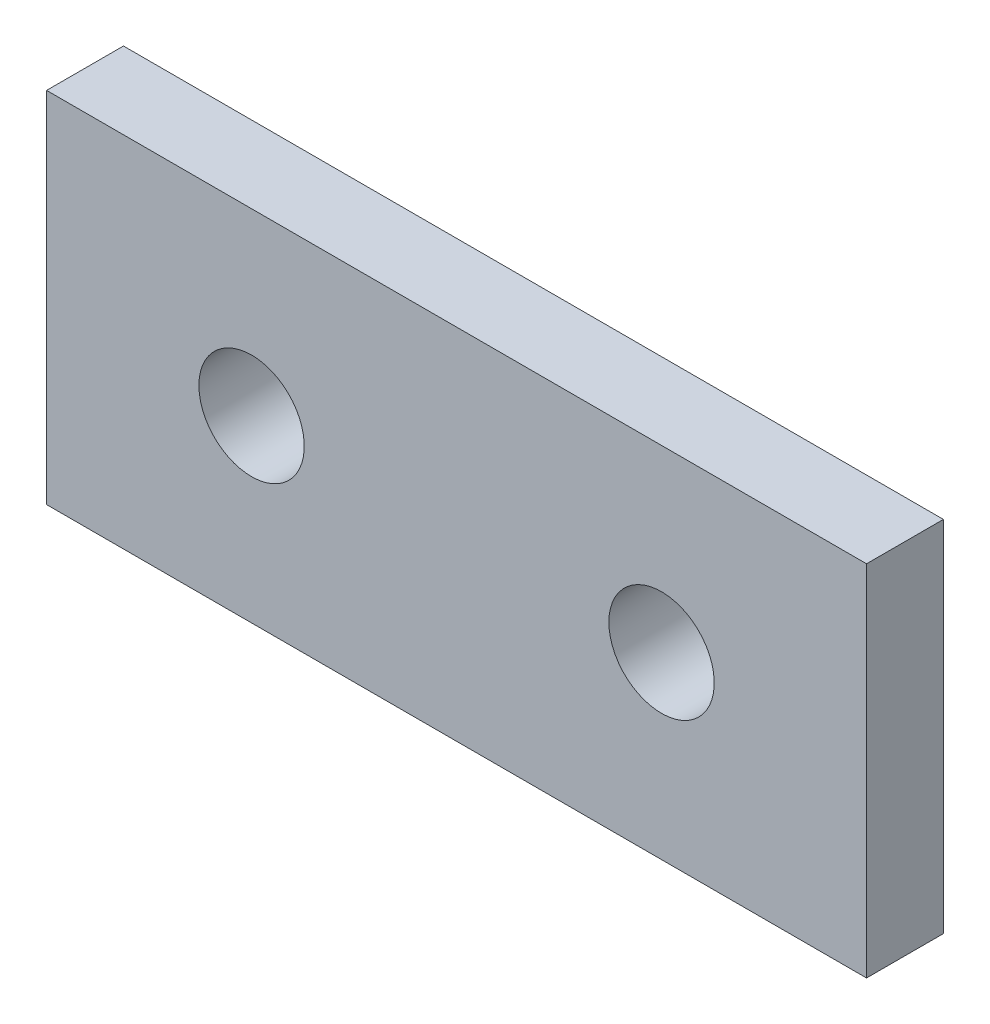
from build123d import *

# Parameters (mm, degrees)
SKETCH1_W           = 50.8
SKETCH1_H           = 22.225
SKETCH1_R           = 3.2639
BOSS_EXTRUDE1_DEPTH = 2.38125


with BuildPart() as part:
    # Sketch1 → Boss-Extrude1 (new, symmetric)
    with BuildSketch(Plane.XY):
        with Locations((25.4, 11.1125)):
            Rectangle(SKETCH1_W, SKETCH1_H)
        with Locations((12.7, 11.1125)):
            Circle(SKETCH1_R, mode=Mode.SUBTRACT)
        with Locations((38.1, 11.1125)):
            Circle(SKETCH1_R, mode=Mode.SUBTRACT)
    extrude(amount=BOSS_EXTRUDE1_DEPTH, both=True)


solid = part.part
